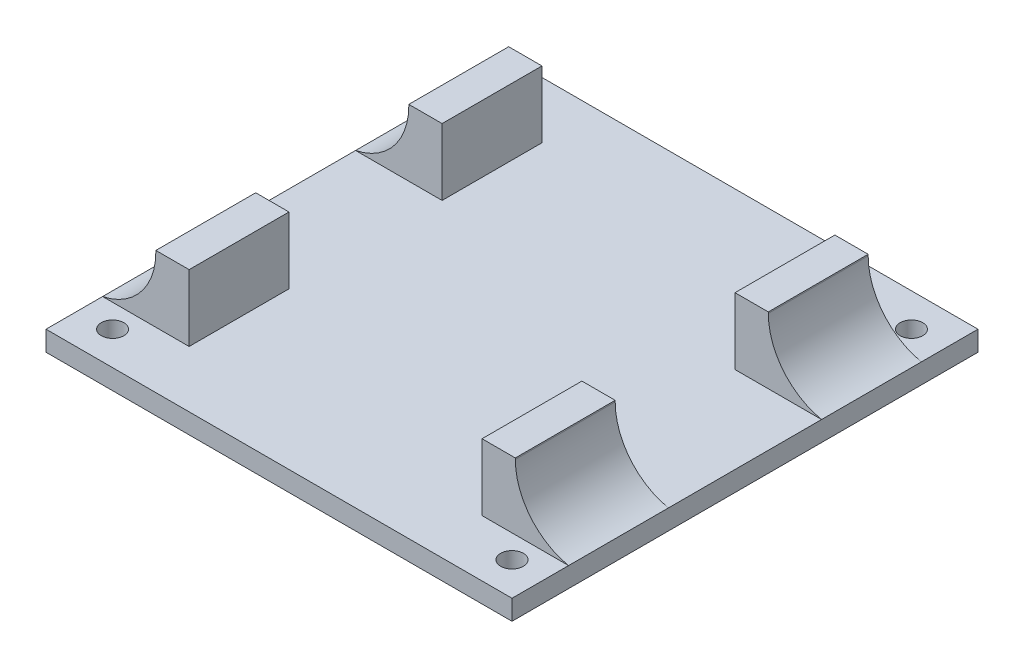
from build123d import *

# Parameters (mm, degrees)
SKETCH1_W           = 70
SKETCH1_H           = 70
SKETCH1_R           = 1.7
PLATE_DEPTH         = 3
SKETCH2_W           = 5
SKETCH2_H           = 15
BOSS_EXTRUDE1_DEPTH = 10
FILLET1_R           = 10


with BuildPart() as part:
    # Sketch1 → Plate (new body)
    with BuildSketch(Plane(origin=(0, 0, 0), x_dir=(1, 0, 0), z_dir=(0, 1, 0))):
        with Locations((35, 35)):
            Rectangle(SKETCH1_W, SKETCH1_H)
        with Locations(Location((65, 65, 0), (0, 0, 270))):
            Circle(SKETCH1_R, mode=Mode.SUBTRACT)
        with Locations(Location((5, 65, 0), (0, 0, 90))):
            Circle(SKETCH1_R, mode=Mode.SUBTRACT)
        with Locations(Location((65, 5, 0), (0, 0, 90))):
            Circle(SKETCH1_R, mode=Mode.SUBTRACT)
        with Locations(Location((5, 5, 0), (0, 0, 270))):
            Circle(SKETCH1_R, mode=Mode.SUBTRACT)
    extrude(amount=PLATE_DEPTH)

    # Sketch2 → Boss-Extrude1 (add)
    with BuildSketch(Plane(origin=(0, 3, 0), x_dir=(1, 0, 0), z_dir=(0, 1, 0))):
        with Locations((10.5, 54)):
            Rectangle(SKETCH2_W, SKETCH2_H)
        with Locations((59.5, 54)):
            Rectangle(SKETCH2_W, SKETCH2_H)
        with Locations((10.5, 16)):
            Rectangle(SKETCH2_W, SKETCH2_H)
        with Locations((59.5, 16)):
            Rectangle(SKETCH2_W, SKETCH2_H)
    extrude(amount=BOSS_EXTRUDE1_DEPTH)

    # Fillet1
    # the kernel refuses this fillet: 10 mm, written as the material it adds along each edge
    with BuildSketch(Plane(origin=(8, 3, -22.005102572), x_dir=(-1, 0, 0), z_dir=(0, 0, -1))) as fillet1_piece_1_section:
        with BuildLine():
            CenterArc((10, 9.797958971), FILLET1_R, 180, 78.463040967)
            Line((0, 9.797958971), (-0.2, 9.797958971))
            Line((-0.2, 9.797958971), (-0.2, 0))
            Line((-0.2, 0), (0, -0.2))
            ThreePointArc((0, -0.2), (4, -0.2), (7.96, -0.195959179))
            Line((7.96, -0.195959179), (8, 0))
        make_face()
    fillet1_piece_1 = extrude(amount=39.494897428, mode=Mode.PRIVATE)
    fillet1_piece_1 = split(fillet1_piece_1, bisect_by=Plane(origin=(6.00439902, 5.286170926, -23.5), z_dir=(0, 0, 1)), keep=Keep.TOP, mode=Mode.PRIVATE)
    add(fillet1_piece_1)
    with BuildSketch(Plane(origin=(8, 3, -46.5), x_dir=(-1, 0, 0), z_dir=(0, 0, -1)), Plane(origin=(62, 3, -61.5), x_dir=(1, 0, 0), z_dir=(0, 0, 1)), Plane(origin=(8, 3, -8.5), x_dir=(-1, 0, 0), z_dir=(0, 0, -1)), Plane(origin=(62, 3, -23.5), x_dir=(1, 0, 0), z_dir=(0, 0, 1))) as fillet1_piece_2:
        with BuildLine():
            CenterArc((10, 9.797958971), FILLET1_R, 180, 78.463040967)
            Line((0, 9.797958971), (-0.2, 9.797958971))
            Line((-0.2, 9.797958971), (-0.2, 0))
            Line((-0.2, 0), (0, -0.2))
            ThreePointArc((0, -0.2), (4, -0.2), (7.96, -0.195959179))
            Line((7.96, -0.195959179), (8, 0))
        make_face()
    extrude(amount=15)
    with BuildSketch(Plane(origin=(62, 3, -61.5), x_dir=(1, 0, 0), z_dir=(0, 0, 1))) as fillet1_piece_3_section:
        with BuildLine():
            CenterArc((10, 9.797958971), FILLET1_R, 180, 78.463040967)
            Line((0, 9.797958971), (-0.2, 9.797958971))
            Line((-0.2, 9.797958971), (-0.2, 0))
            Line((-0.2, 0), (0, -0.2))
            ThreePointArc((0, -0.2), (4, -0.2), (7.96, -0.195959179))
            Line((7.96, -0.195959179), (8, 0))
        make_face()
    fillet1_piece_3 = extrude(amount=39.494897428, mode=Mode.PRIVATE)
    fillet1_piece_3 = split(fillet1_piece_3, bisect_by=Plane(origin=(63.99560098, 5.286170926, -23.5), z_dir=(0, 0, 1)), keep=Keep.TOP, mode=Mode.PRIVATE)
    add(fillet1_piece_3)
    with BuildSketch(Plane(origin=(8, 3, -8.5), x_dir=(-1, 0, 0), z_dir=(0, 0, -1))) as fillet1_piece_4_section:
        with BuildLine():
            CenterArc((10, 9.797958971), FILLET1_R, 180, 78.463040967)
            Line((0, 9.797958971), (-0.2, 9.797958971))
            Line((-0.2, 9.797958971), (-0.2, 0))
            Line((-0.2, 0), (0, -0.2))
            ThreePointArc((0, -0.2), (4, -0.2), (7.96, -0.195959179))
            Line((7.96, -0.195959179), (8, 0))
        make_face()
    fillet1_piece_4 = extrude(amount=39.494897428, mode=Mode.PRIVATE)
    fillet1_piece_4 = split(fillet1_piece_4, bisect_by=Plane(origin=(6.00439902, 5.286170926, -46.5), z_dir=(0, 0, -1)), keep=Keep.TOP, mode=Mode.PRIVATE)
    add(fillet1_piece_4)
    with BuildSketch(Plane(origin=(62, 3, -47.994897428), x_dir=(1, 0, 0), z_dir=(0, 0, 1))) as fillet1_piece_5_section:
        with BuildLine():
            CenterArc((10, 9.797958971), FILLET1_R, 180, 78.463040967)
            Line((0, 9.797958971), (-0.2, 9.797958971))
            Line((-0.2, 9.797958971), (-0.2, 0))
            Line((-0.2, 0), (0, -0.2))
            ThreePointArc((0, -0.2), (4, -0.2), (7.96, -0.195959179))
            Line((7.96, -0.195959179), (8, 0))
        make_face()
    fillet1_piece_5 = extrude(amount=39.494897428, mode=Mode.PRIVATE)
    fillet1_piece_5 = split(fillet1_piece_5, bisect_by=Plane(origin=(63.99560098, 5.286170926, -46.5), z_dir=(0, 0, -1)), keep=Keep.TOP, mode=Mode.PRIVATE)
    add(fillet1_piece_5)


solid = part.part
